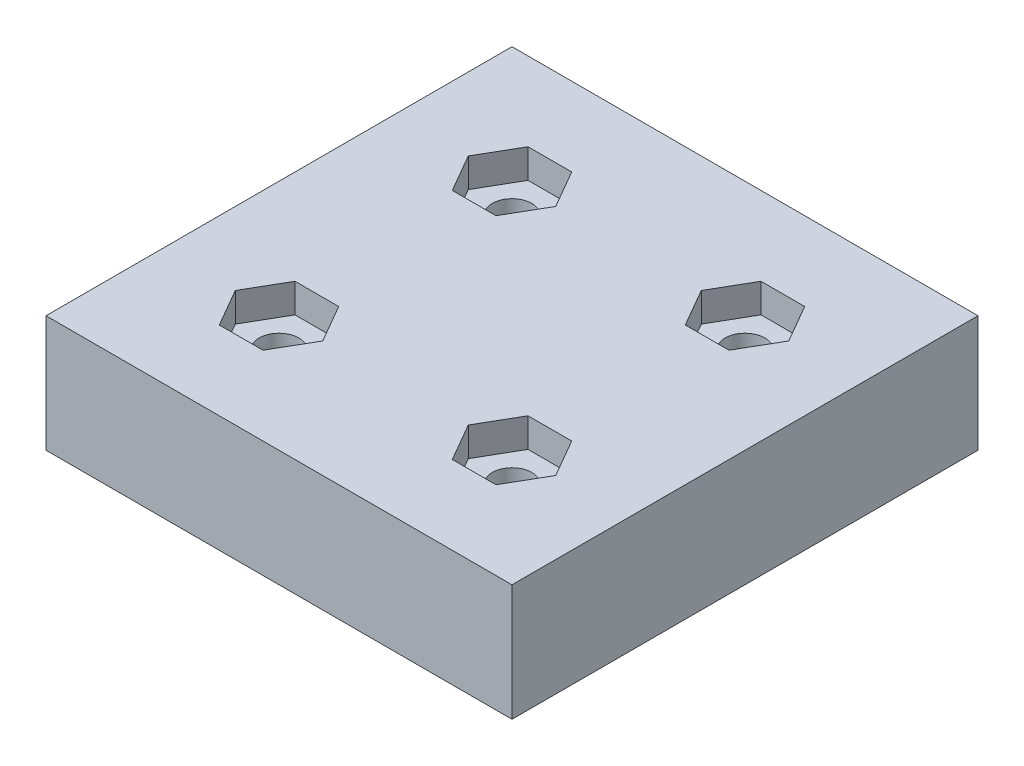
from build123d import *

# Parameters (mm, degrees)
SKETCH1_W           = 40
SKETCH1_H           = 40
SKETCH1_R           = 1.7
BOSS_EXTRUDE1_DEPTH = 10
CUT_EXTRUDE1_DEPTH  = 2.5


with BuildPart() as part:
    # Sketch1 → Boss-Extrude1 (new body)
    with BuildSketch(Plane(origin=(0, 0, 0), x_dir=(1, 0, 0), z_dir=(0, 1, 0))):
        with Locations((20, 20)):
            Rectangle(SKETCH1_W, SKETCH1_H)
        with Locations((10, 30)):
            Circle(SKETCH1_R, mode=Mode.SUBTRACT)
        with Locations((30, 30)):
            Circle(SKETCH1_R, mode=Mode.SUBTRACT)
        with Locations((30, 10)):
            Circle(SKETCH1_R, mode=Mode.SUBTRACT)
        with Locations((10, 10)):
            Circle(SKETCH1_R, mode=Mode.SUBTRACT)
    extrude(amount=BOSS_EXTRUDE1_DEPTH)

    # Sketch2 → Cut-Extrude1 (cut)
    with BuildSketch(Plane(origin=(0, 10, 0), x_dir=(1, 0, 0), z_dir=(0, 1, 0))):
        Polygon((13.75277675, 10), (11.876388375, 13.25), (8.123611625, 13.25), (6.24722325, 10), (8.123611625, 6.75), (11.876388375, 6.75), align=None)
        Polygon((26.24722325, 10), (28.123611625, 6.75), (31.876388375, 6.75), (33.75277675, 10), (31.876388375, 13.25), (28.123611625, 13.25), align=None)
        Polygon((26.24722325, 30), (28.123611625, 26.75), (31.876388375, 26.75), (33.75277675, 30), (31.876388375, 33.25), (28.123611625, 33.25), align=None)
        Polygon((13.75277675, 30), (11.876388375, 33.25), (8.123611625, 33.25), (6.24722325, 30), (8.123611625, 26.75), (11.876388375, 26.75), align=None)
    extrude(amount=-CUT_EXTRUDE1_DEPTH, mode=Mode.SUBTRACT)


solid = part.part
